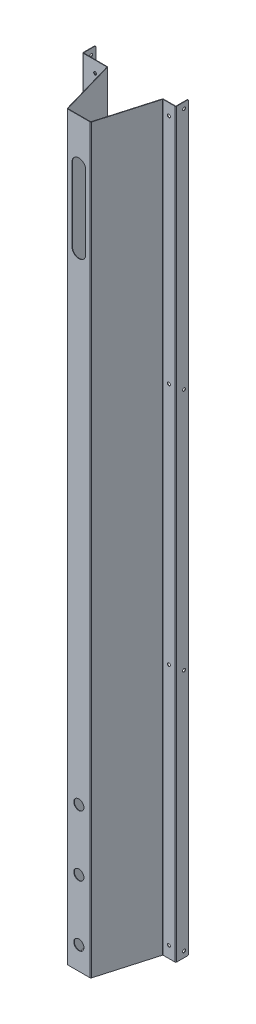
from build123d import *

# Parameters (mm, degrees)
BASE_FLANGE1_DEPTH  = 1613
FILLET1_R           = 3
CUT_EXTRUDE1_REACH  = 1625.966
SKETCH6_R           = 11
LPATTERN1_COUNT     = 3
LPATTERN1_PITCH     = 132
CUT_EXTRUDE4_REACH  = 1634.045
SKETCH10_R          = 3.25
LPATTERN5_COUNT     = 4
LPATTERN5_PITCH     = 529
CUT_EXTRUDE5_REACH  = 1623.619
CUT_EXTRUDE6_REACH  = 1623.619
SKETCH13_R          = 3.25
CUT_EXTRUDE7_REACH  = 1623.619
SKETCH14_R          = 3.25
LPATTERN6_COUNT     = 3
LPATTERN6_PITCH     = 529
CUT_EXTRUDE8_REACH  = 1623.619
SKETCH15_R          = 3.25
CUT_EXTRUDE9_REACH  = 1623.619
SKETCH16_R          = 3.25
CUT_EXTRUDE10_REACH = 1625.966


# Sheet-metal steps are written as plain solids
with BuildPart() as part:
    # Sketch1 → Base-Flange1 (new body)
    with BuildSketch(Plane(origin=(0, 0, 0), x_dir=(1, 0, 0), z_dir=(0, 1, 0))):
        with BuildLine():
            Line((-113, 149), (-113, 123))
            ThreePointArc((-113, 123), (-112.707106781, 122.292893219), (-112, 122))
            Line((-112, 122), (-61.506905499, 122))
            ThreePointArc((-61.506905499, 122), (-60.303378662, 121.597348789), (-59.584453364, 120.551523153))
            Line((-59.584453364, 120.551523153), (-25.207773318, 0.724238423))
            ThreePointArc((-25.207773318, 0.724238423), (-24.848310669, 0.201325606), (-24.246547251, 0))
            Line((-24.246547251, 0), (24.246547251, 0))
            ThreePointArc((24.246547251, 0), (24.848310669, 0.201325606), (25.207773318, 0.724238423))
            Line((25.207773318, 0.724238423), (59.584453364, 120.551523153))
            ThreePointArc((59.584453364, 120.551523153), (60.303378662, 121.597348789), (61.506905499, 122))
            Line((61.506905499, 122), (87, 122))
            ThreePointArc((87, 122), (87.707106781, 122.292893219), (88, 123))
            Line((88, 123), (88, 149))
            Line((88, 149), (89, 149))
            Line((89, 149), (89, 123))
            ThreePointArc((89, 123), (88.414213562, 121.585786438), (87, 121))
            Line((87, 121), (61.506905499, 121))
            ThreePointArc((61.506905499, 121), (60.90514208, 120.798674394), (60.545679431, 120.275761577))
            Line((60.545679431, 120.275761577), (26.168999386, 0.448476847))
            ThreePointArc((26.168999386, 0.448476847), (25.450074087, -0.597348789), (24.246547251, -1))
            Line((24.246547251, -1), (-24.246547251, -1))
            ThreePointArc((-24.246547251, -1), (-25.450074087, -0.597348789), (-26.168999386, 0.448476847))
            Line((-26.168999386, 0.448476847), (-60.545679431, 120.275761577))
            ThreePointArc((-60.545679431, 120.275761577), (-60.90514208, 120.798674394), (-61.506905499, 121))
            Line((-61.506905499, 121), (-112, 121))
            ThreePointArc((-112, 121), (-113.414213562, 121.585786438), (-114, 123))
            Line((-114, 123), (-114, 149))
            Line((-114, 149), (-113, 149))
        make_face()
    extrude(amount=BASE_FLANGE1_DEPTH)

    # Fillet1
    fillet1_edges = [part.edges().sort_by_distance(p)[0] for p in [
        (-113.5, 0, -149),
        (88.5, 0, -149),
        (-113.5, 1613, -149),
        (88.5, 1613, -149),
    ]]
    fillet(fillet1_edges, radius=FILLET1_R)

    # Sketch6 → Cut-Extrude1 (cut, up to next)
    with BuildSketch(Plane.XY.offset(1), mode=Mode.PRIVATE) as cut_extrude1_sk1:
        with Locations((0, 50)):
            Circle(SKETCH6_R)
    cut_extrude1_tool1 = extrude(cut_extrude1_sk1.sketch, amount=-CUT_EXTRUDE1_REACH, mode=Mode.PRIVATE) & part.part
    cut_extrude1 = cut_extrude1_tool1.solids().sort_by_distance((0, 50, 1))[0]
    add(cut_extrude1, mode=Mode.SUBTRACT)

    # LPattern1: Cut-Extrude1 ×3
    with Locations(*[(0, i * LPATTERN1_PITCH, 0) for i in range(1, LPATTERN1_COUNT)]):
        add(cut_extrude1, mode=Mode.SUBTRACT)

    # Cut-Extrude4: up to this face of the body (flat: up to its plane)
    cut_extrude4_end = Plane(part.part.faces().sort_by_distance((-114, 806.5, -135.998864211))[0])
    # Sketch10 → Cut-Extrude4 (cut, up to the picked face)
    with BuildSketch(Plane(origin=(89, 0, -5.5), x_dir=(0, 0, -1), z_dir=(1, 0, 0)), mode=Mode.PRIVATE) as cut_extrude4_sk1:
        with Locations((133.5, 13)):
            Circle(SKETCH10_R)
    cut_extrude4_tool1 = split(extrude(cut_extrude4_sk1.sketch, amount=-CUT_EXTRUDE4_REACH, mode=Mode.PRIVATE), bisect_by=cut_extrude4_end, keep=Keep.BOTH, mode=Mode.PRIVATE)
    cut_extrude4 = cut_extrude4_tool1.solids().sort_by(Axis((89, 13, -139), (-1, 0, 0)))[0]
    add(cut_extrude4, mode=Mode.SUBTRACT)

    # LPattern5: Cut-Extrude4 ×4
    with Locations(*[(0, i * LPATTERN5_PITCH, 0) for i in range(1, LPATTERN5_COUNT)]):
        add(cut_extrude4, mode=Mode.SUBTRACT)

    # Sketch12 → Cut-Extrude5 (cut, up to next)
    with BuildSketch(Plane.XY.offset(-121), mode=Mode.PRIVATE) as cut_extrude5_sk1:
        with BuildLine():
            Line((-70.006905499, 1447), (-70.006905499, 1417))
            ThreePointArc((-70.006905499, 1417), (-85.006905499, 1402), (-100.006905499, 1417))
            Line((-100.006905499, 1417), (-100.006905499, 1447))
            ThreePointArc((-100.006905499, 1447), (-85.006905499, 1462), (-70.006905499, 1447))
        make_face()
    cut_extrude5_tool1 = extrude(cut_extrude5_sk1.sketch, amount=-CUT_EXTRUDE5_REACH, mode=Mode.PRIVATE) & part.part
    add(cut_extrude5_tool1.solids().sort_by_distance((-85.006905, 1432, -121))[0], mode=Mode.SUBTRACT)

    # Sketch13 → Cut-Extrude6 (cut, up to next)
    with BuildSketch(Plane.XY.offset(-121), mode=Mode.PRIVATE) as cut_extrude6_sk1:
        with Locations((-86.506905499, 25)):
            Circle(SKETCH13_R)
    cut_extrude6_tool1 = extrude(cut_extrude6_sk1.sketch, amount=-CUT_EXTRUDE6_REACH, mode=Mode.PRIVATE) & part.part
    cut_extrude6 = cut_extrude6_tool1.solids().sort_by_distance((-86.506905, 25, -121))[0]
    add(cut_extrude6, mode=Mode.SUBTRACT)

    # Sketch14 → Cut-Extrude7 (cut, up to next)
    with BuildSketch(Plane.XY.offset(-121), mode=Mode.PRIVATE) as cut_extrude7_sk1:
        with Locations((74.006905499, 25)):
            Circle(SKETCH14_R)
    cut_extrude7_tool1 = extrude(cut_extrude7_sk1.sketch, amount=-CUT_EXTRUDE7_REACH, mode=Mode.PRIVATE) & part.part
    cut_extrude7 = cut_extrude7_tool1.solids().sort_by_distance((74.006905, 25, -121))[0]
    add(cut_extrude7, mode=Mode.SUBTRACT)

    # LPattern6: Cut-Extrude6, Cut-Extrude7 ×3
    with Locations(*[(0, i * LPATTERN6_PITCH, 0) for i in range(1, LPATTERN6_COUNT)]):
        add(cut_extrude6, mode=Mode.SUBTRACT)
        add(cut_extrude7, mode=Mode.SUBTRACT)

    # Sketch15 → Cut-Extrude8 (cut, up to next)
    with BuildSketch(Plane.XY.offset(-121), mode=Mode.PRIVATE) as cut_extrude8_sk1:
        with Locations((-86.506905499, 1588)):
            Circle(SKETCH15_R)
    cut_extrude8_tool1 = extrude(cut_extrude8_sk1.sketch, amount=-CUT_EXTRUDE8_REACH, mode=Mode.PRIVATE) & part.part
    add(cut_extrude8_tool1.solids().sort_by_distance((-86.506905, 1588, -121))[0], mode=Mode.SUBTRACT)

    # Sketch16 → Cut-Extrude9 (cut, up to next)
    with BuildSketch(Plane.XY.offset(-121), mode=Mode.PRIVATE) as cut_extrude9_sk1:
        with Locations((74.006905499, 1588)):
            Circle(SKETCH16_R)
    cut_extrude9_tool1 = extrude(cut_extrude9_sk1.sketch, amount=-CUT_EXTRUDE9_REACH, mode=Mode.PRIVATE) & part.part
    add(cut_extrude9_tool1.solids().sort_by_distance((74.006905, 1588, -121))[0], mode=Mode.SUBTRACT)

    # Sketch17 → Cut-Extrude10 (cut, up to next)
    with BuildSketch(Plane.XY.offset(1), mode=Mode.PRIVATE) as cut_extrude10_sk1:
        with BuildLine():
            Line((15, 1518), (15, 1358))
            ThreePointArc((15, 1358), (0, 1343), (-15, 1358))
            Line((-15, 1358), (-15, 1518))
            ThreePointArc((-15, 1518), (0, 1533), (15, 1518))
        make_face()
    cut_extrude10_tool1 = extrude(cut_extrude10_sk1.sketch, amount=-CUT_EXTRUDE10_REACH, mode=Mode.PRIVATE) & part.part
    add(cut_extrude10_tool1.solids().sort_by_distance((0, 1438, 1))[0], mode=Mode.SUBTRACT)


solid = part.part
